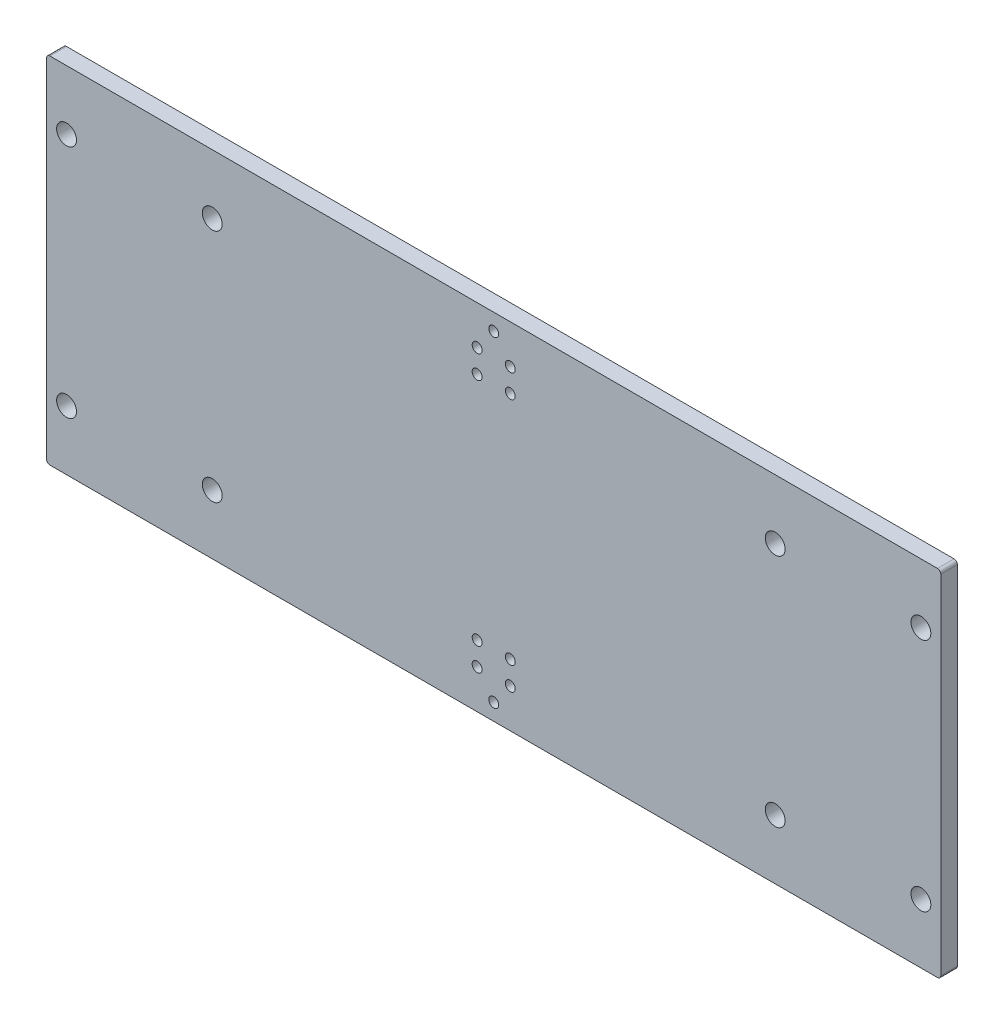
from build123d import *

# Parameters (mm, degrees)
SKETCH_1_W             = 270
SKETCH_1_H             = 107
SM_BASE_FLANGE_1_DEPTH = 5
SKETCH_6_R             = 3
CUT_EXTRUDE_1_DEPTH    = 10
SKETCH_7_R             = 1.5
CUT_EXTRUDE_2_DEPTH    = 10
FILLET_1_R             = 1
SKETCH_8_R             = 1.5
CUT_EXTRUDE_3_DEPTH    = 10


# Sheet-metal steps are written as plain solids
with BuildPart() as part:
    # Sketch 1 → 基体-法兰1 (new body)
    with BuildSketch(Plane.XY):
        Rectangle(SKETCH_1_W, SKETCH_1_H)
    extrude(amount=-SM_BASE_FLANGE_1_DEPTH)

    # 草图6 → 切除-拉伸1 (cut)
    with BuildSketch(Plane.XY):
        with Locations((-129, 35.5)):
            Circle(SKETCH_6_R)
        with Locations((-129, -35.5)):
            Circle(SKETCH_6_R)
        with Locations((-85, 35.5)):
            Circle(SKETCH_6_R)
        with Locations((-85, -35.5)):
            Circle(SKETCH_6_R)
    cut_extrude_1 = extrude(amount=-CUT_EXTRUDE_1_DEPTH, mode=Mode.SUBTRACT)

    # 镜向1: 切除-拉伸1 across plane
    add(cut_extrude_1.mirror(Plane(origin=(0, 0, 0), x_dir=(0, 0, 1), z_dir=(1, 0, 0))), mode=Mode.SUBTRACT)

    # 草图7 → 切除-拉伸2 (cut)
    with BuildSketch(Plane.XY):
        with Locations((0, 48.5)):
            Circle(SKETCH_7_R)
    cut_extrude_2 = extrude(amount=-CUT_EXTRUDE_2_DEPTH, mode=Mode.SUBTRACT)

    # 镜向2: 切除-拉伸2 across plane
    add(cut_extrude_2.mirror(Plane.ZX), mode=Mode.SUBTRACT)

    # 圆角1
    fillet_1_edges = [part.edges().sort_by_distance(p)[0] for p in [
        (135, -53.5, -2.5),
        (-135, -53.5, -2.5),
        (-135, 53.5, -2.5),
        (135, 53.5, -2.5),
    ]]
    fillet(fillet_1_edges, radius=FILLET_1_R)

    # 草图8 → 切除-拉伸3 (cut)
    with BuildSketch(Plane(origin=(0, 0, -5), x_dir=(-1, 0, 0), z_dir=(0, 0, -1))):
        with Locations((-5, 41.75)):
            Circle(SKETCH_8_R)
        with Locations((5, 41.75)):
            Circle(SKETCH_8_R)
        with Locations((5, 34.75)):
            Circle(SKETCH_8_R)
        with Locations((-5, 34.75)):
            Circle(SKETCH_8_R)
    cut_extrude_3 = extrude(amount=-CUT_EXTRUDE_3_DEPTH, mode=Mode.SUBTRACT)

    # 镜向3: 切除-拉伸3 across plane
    add(cut_extrude_3.mirror(Plane.ZX), mode=Mode.SUBTRACT)


solid = part.part
